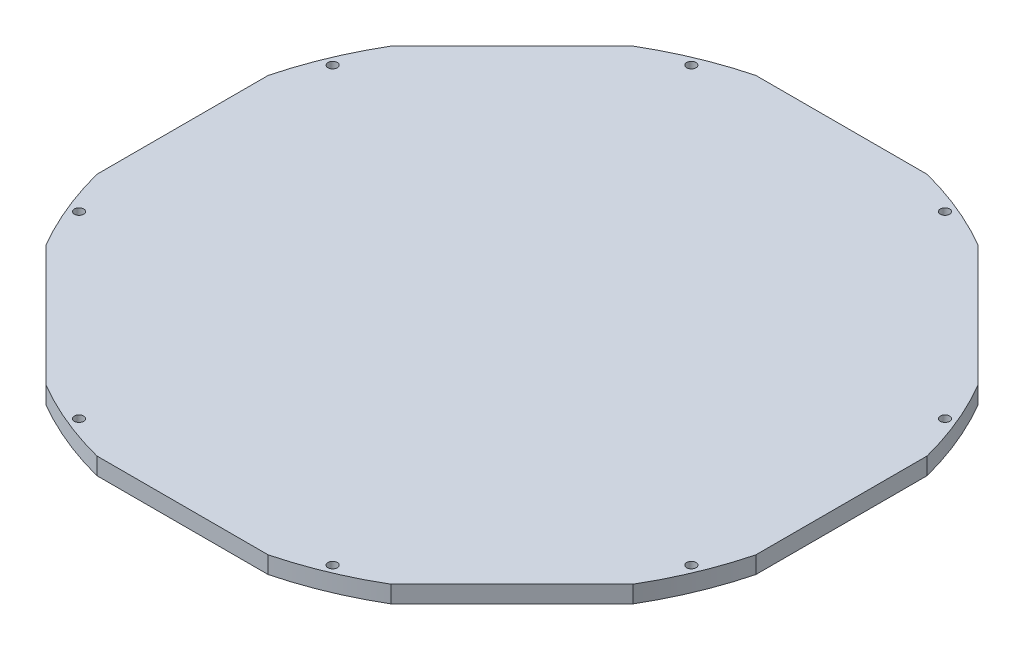
from build123d import *

# Parameters (mm, degrees)
BOSS_EXTRUDE1_DEPTH   = 6.35
SKETCH2_R             = 119.0625
SKETCH2_R_2           = 115.2525
CUT_EXTRUDE1_DEPTH    = 2.667
F_8_32_TAPPED_HOLE1_D = 3.4544
CIRPATTERN1_COUNT     = 8


with BuildPart() as part:
    # Sketch1 → Boss-Extrude1 (new body)
    with BuildSketch(Plane(origin=(0, 0, 0), x_dir=(1, 0, 0), z_dir=(0, 1, 0))):
        with BuildLine():
            ThreePointArc((-31.793446259, 122.3), (-48.357791931, 116.746037126), (-63.997797892, 108.960520786))
            Line((-63.997797892, 108.960520786), (-108.960520786, 63.997797892))
            ThreePointArc((-108.960520786, 63.997797892), (-116.746037126, 48.357791931), (-122.3, 31.793446259))
            Line((-122.3, 31.793446259), (-122.3, -31.793446259))
            ThreePointArc((-122.3, -31.793446259), (-116.746037126, -48.357791931), (-108.960520786, -63.997797892))
            Line((-108.960520786, -63.997797892), (-63.997797892, -108.960520786))
            ThreePointArc((-63.997797892, -108.960520786), (-48.357791931, -116.746037126), (-31.793446259, -122.3))
            Line((-31.793446259, -122.3), (31.793446259, -122.3))
            ThreePointArc((31.793446259, -122.3), (48.357791931, -116.746037126), (63.997797892, -108.960520786))
            Line((63.997797892, -108.960520786), (108.960520786, -63.997797892))
            ThreePointArc((108.960520786, -63.997797892), (116.746037126, -48.357791931), (122.3, -31.793446259))
            Line((122.3, -31.793446259), (122.3, 31.793446259))
            ThreePointArc((122.3, 31.793446259), (116.746037126, 48.357791931), (108.960520786, 63.997797892))
            Line((108.960520786, 63.997797892), (63.997797892, 108.960520786))
            ThreePointArc((63.997797892, 108.960520786), (48.357791931, 116.746037126), (31.793446259, 122.3))
            Line((31.793446259, 122.3), (-31.793446259, 122.3))
        make_face()
    extrude(amount=BOSS_EXTRUDE1_DEPTH)

    # Sketch2 → Cut-Extrude1 (cut)
    with BuildSketch(Plane.XZ):
        Circle(SKETCH2_R)
        Circle(SKETCH2_R_2, mode=Mode.SUBTRACT)
    extrude(amount=-CUT_EXTRUDE1_DEPTH, mode=Mode.SUBTRACT)

    # #8-32 Tapped Hole1 (through all)
    with Locations(Plane(origin=(0, 6.35, 0), x_dir=(1, 0, 0), z_dir=(0, 1, 0))):
        with Locations((-47.069870839, 113.636720559)):
            f_8_32_tapped_hole1 = Hole(F_8_32_TAPPED_HOLE1_D / 2)

    # CirPattern1: #8-32 Tapped Hole1 ×8 about axis
    cirpattern1_axis = Axis((0, 6.35, 0), (0, -1, 0))
    for i in range(1, CIRPATTERN1_COUNT):
        add(f_8_32_tapped_hole1.rotate(cirpattern1_axis, i * 360 / CIRPATTERN1_COUNT), mode=Mode.SUBTRACT)


solid = part.part
